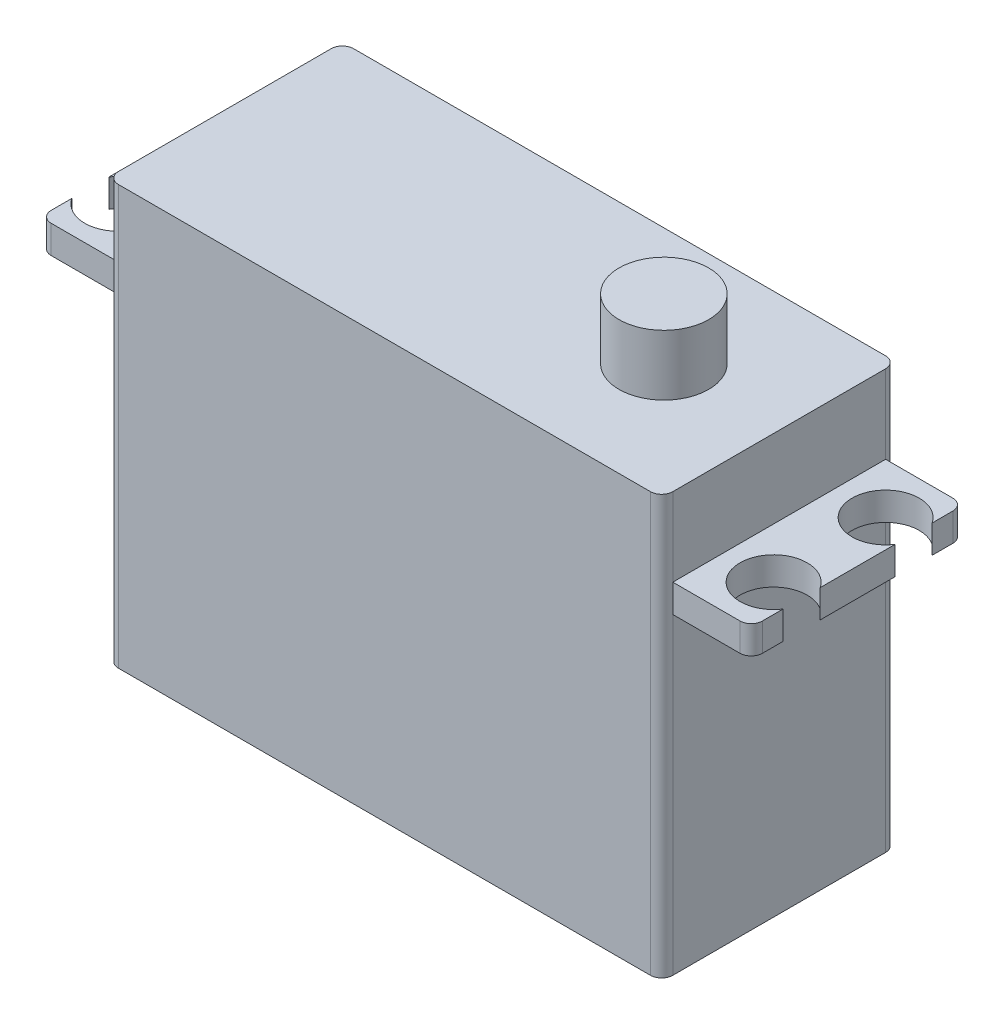
from build123d import *

# Parameters (mm, degrees)
SKETCH_1_W          = 49.5
SKETCH_1_H          = 21
EXTRUDE_1_DEPTH     = 30.4
SKETCH_2_W          = 19
SKETCH_2_H          = 2.5
EXTRUDE_2_DEPTH     = 7
SKETCH_3_W          = 49.5
SKETCH_3_H          = 21
EXTRUDE_3_DEPTH     = 7
SKETCH_4_R          = 3
CUT_EXTRUDE_1_DEPTH = 7
SKETCH_5_R          = 4
EXTRUDE_4_DEPTH     = 5.4
FILLET_1_R          = 1
FILLET_2_R          = 1
FILLET_3_R          = 1
FILLET_4_R          = 1
FILLET_5_R          = 1
FILLET_6_R          = 1
FILLET_7_R          = 1
FILLET_8_R          = 1


with BuildPart() as part:
    # 草图1 → 凸台-拉伸1 (new body)
    with BuildSketch(Plane(origin=(0, 0, 0), x_dir=(1, 0, 0), z_dir=(0, 1, 0))):
        Rectangle(SKETCH_1_W, SKETCH_1_H)
    extrude(amount=EXTRUDE_1_DEPTH)

    # 草图2 → 凸台-拉伸2 (add)
    with BuildSketch(Plane(origin=(24.75, 0, 0), x_dir=(0, 0, -1), z_dir=(1, 0, 0))):
        with Locations((0, 29.15)):
            Rectangle(SKETCH_2_W, SKETCH_2_H)
    extrude_2 = extrude(amount=EXTRUDE_2_DEPTH)

    # 草图3 → 凸台-拉伸3 (add)
    with BuildSketch(Plane(origin=(0, 30.4, 0), x_dir=(1, 0, 0), z_dir=(0, 1, 0))):
        Rectangle(SKETCH_3_W, SKETCH_3_H)
    extrude(amount=EXTRUDE_3_DEPTH)

    # 草图4 → 切除-拉伸1 (cut)
    with BuildSketch(Plane(origin=(0, 30.4, 0), x_dir=(1, 0, 0), z_dir=(0, 1, 0))):
        with Locations((29.25, 5)):
            Circle(SKETCH_4_R)
        with Locations((29.25, -5)):
            Circle(SKETCH_4_R)
    cut_extrude_1 = extrude(amount=-CUT_EXTRUDE_1_DEPTH, mode=Mode.SUBTRACT)

    # 草图5 → 凸台-拉伸4 (add)
    with BuildSketch(Plane(origin=(0, 37.4, 0), x_dir=(1, 0, 0), z_dir=(0, 1, 0))):
        with Locations(Location((14.45, 0, 0), (0, 0, 90))):
            Circle(SKETCH_5_R)
    extrude(amount=EXTRUDE_4_DEPTH)

    # 镜向2: 凸台-拉伸2, 切除-拉伸1 across plane
    add(extrude_2.mirror(Plane(origin=(0, 0, 0), x_dir=(0, 0, 1), z_dir=(1, 0, 0))))
    add(cut_extrude_1.mirror(Plane(origin=(0, 0, 0), x_dir=(0, 0, 1), z_dir=(1, 0, 0))), mode=Mode.SUBTRACT)

    # 圆角1
    fillet_1_edges = [part.edges().sort_by_distance(p)[0] for p in [
        (24.75, 18.7, -10.5),
    ]]
    fillet(fillet_1_edges, radius=FILLET_1_R - 0.0001)  # a hair under: the kernel refuses the full size

    # 圆角2
    fillet_2_edges = [part.edges().sort_by_distance(p)[0] for p in [
        (24.75, 18.7, 10.5),
    ]]
    fillet(fillet_2_edges, radius=FILLET_2_R - 0.0001)  # a hair under: the kernel refuses the full size

    # 圆角3
    fillet_3_edges = [part.edges().sort_by_distance(p)[0] for p in [
        (-24.75, 18.7, 10.5),
    ]]
    fillet(fillet_3_edges, radius=FILLET_3_R - 0.0001)  # a hair under: the kernel refuses the full size

    # 圆角4
    fillet_4_edges = [part.edges().sort_by_distance(p)[0] for p in [
        (-24.75, 18.7, -10.5),
    ]]
    fillet(fillet_4_edges, radius=FILLET_4_R - 0.0001)  # a hair under: the kernel refuses the full size

    # 圆角5
    fillet_5_edges = [part.edges().sort_by_distance(p)[0] for p in [
        (-31.75, 29.15, -9.5),
    ]]
    fillet(fillet_5_edges, radius=FILLET_5_R)

    # 圆角6
    fillet_6_edges = [part.edges().sort_by_distance(p)[0] for p in [
        (-31.75, 29.15, 9.5),
    ]]
    fillet(fillet_6_edges, radius=FILLET_6_R)

    # 圆角7
    fillet_7_edges = [part.edges().sort_by_distance(p)[0] for p in [
        (31.75, 29.15, 9.5),
    ]]
    fillet(fillet_7_edges, radius=FILLET_7_R)

    # 圆角8
    fillet_8_edges = [part.edges().sort_by_distance(p)[0] for p in [
        (31.75, 29.15, -9.5),
    ]]
    fillet(fillet_8_edges, radius=FILLET_8_R)


solid = part.part
